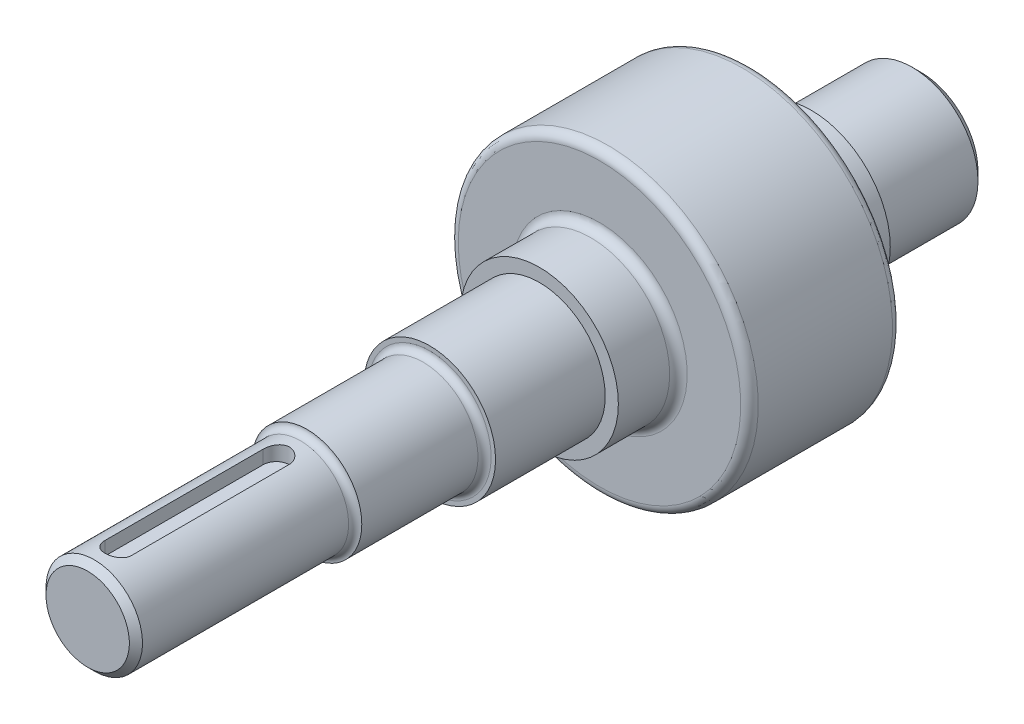
from build123d import *

# Parameters (mm, degrees)
SKETCH3_R               = 34.2032822
BOSS_EXTRUDE1_DEPTH     = 34.6
FILLET1_R               = 1.5
FILLET2_R               = 2
CHAMFER2_SIZE           = 1.5
CHAMFER3_SIZE           = 2
SKETCH4_R               = 29.8214615
DF1_DEPTH               = 34.6
FILLET3_R               = 2
CUT_EXTRUDE1_REACH      = 199.507
CUT_EXTRUDE1_END_RADIUS = 11


with BuildPart() as part:
    # Sketch2 → Revolve1 (revolve)
    with BuildSketch(Plane(origin=(0, 0, 0), x_dir=(0, 0, -1), z_dir=(1, 0, 0)), mode=Mode.PRIVATE) as revolve1_sk:
        Polygon((0, 0), (0, 11), (50, 11), (50, 12.5), (78, 12.5), (78, 15), (103, 15), (103, 18), (165, 18), (165, 15), (190, 15), (190, 0), align=None)
    revolve(revolve1_sk.sketch.rotate(Axis((0, 0, 0), (0, 0, -1)), 90), axis=Axis((0, 0, 0), (0, 0, -1)))

    # Sketch3 → Boss-Extrude1 (add)
    with BuildSketch(Plane(origin=(0, 0, -151.3), x_dir=(-1, 0, 0), z_dir=(0, 0, -1))):
        Circle(SKETCH3_R)
    extrude(amount=-BOSS_EXTRUDE1_DEPTH)

    # Fillet1
    fillet1_edges = [part.edges().sort_by_distance(p)[0] for p in [
        (-12.5, 0, -78),
        (-11, 0, -50),
    ]]
    fillet(fillet1_edges, radius=FILLET1_R - 0.0001)  # a hair under: the kernel refuses the full size

    # Fillet2
    fillet2_edges = [part.edges().sort_by_distance(p)[0] for p in [
        (-18, 0, -116.7),
        (-18, 0, -151.3),
    ]]
    fillet(fillet2_edges, radius=FILLET2_R)

    # Chamfer2
    chamfer2_edges = [part.edges().sort_by_distance(p)[0] for p in [
        (-11, 0, 0),
    ]]
    chamfer(chamfer2_edges, length=CHAMFER2_SIZE)

    # Chamfer3
    chamfer3_edges = [part.edges().sort_by_distance(p)[0] for p in [
        (-15, 0, -190),
    ]]
    chamfer(chamfer3_edges, length=CHAMFER3_SIZE)

    # Sketch4 → df1 (add)
    with BuildSketch(Plane.XY.offset(-116.7)):
        Circle(SKETCH4_R)
    extrude(amount=-DF1_DEPTH)

    # Fillet3
    fillet3_edges = [part.edges().sort_by_distance(p)[0] for p in [
        (34.2032822, 0, -116.7),
        (34.2032822, 0, -151.3),
    ]]
    fillet(fillet3_edges, radius=FILLET3_R)

    # Cut-Extrude1: up to this cylinder (the profile starts inside it)
    cut_extrude1_end = Plane(origin=(0, 0, -25), z_dir=(0, 0, 1)) * Cylinder(CUT_EXTRUDE1_END_RADIUS, 422.014, mode=Mode.PRIVATE)
    # Sketch5 → Cut-Extrude1 (cut, up to the surface)
    with BuildSketch(Plane(origin=(0, 7.5, 0), x_dir=(1, 0, 0), z_dir=(0, 1, 0)), mode=Mode.PRIVATE) as cut_extrude1_sk1:
        with BuildLine():
            Line((3, 43), (3, 7))
            ThreePointArc((3, 7), (0, 4), (-3, 7))
            Line((-3, 7), (-3, 43))
            ThreePointArc((-3, 43), (0, 46), (3, 43))
        make_face()
    cut_extrude1_tool1 = extrude(cut_extrude1_sk1.sketch, amount=CUT_EXTRUDE1_REACH, mode=Mode.PRIVATE) & cut_extrude1_end
    add(cut_extrude1_tool1.solids().sort_by_distance((0, 7.5, -25))[0], mode=Mode.SUBTRACT)


solid = part.part
